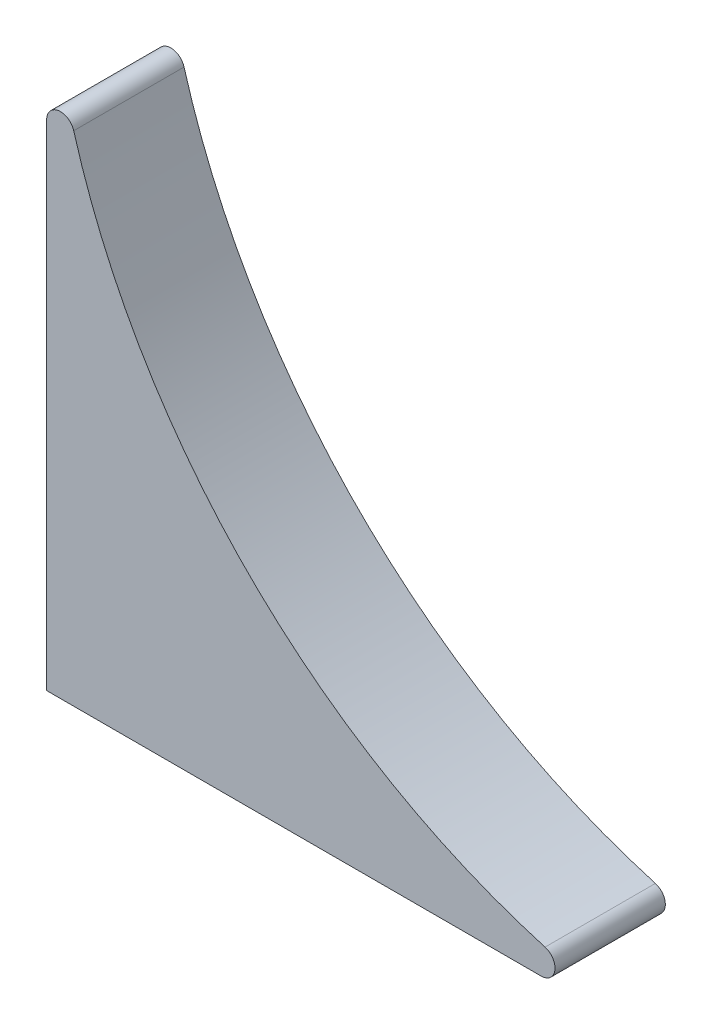
from build123d import *

# Parameters (mm, degrees)
AUFSATZ_LINEAR_AUSTRAGEN1_DEPTH = 4
VERRUNDUNG1_R                   = 0.5


with BuildPart() as part:
    # Skizze1 → Aufsatz-Linear austragen1 (new body)
    with BuildSketch(Plane.XY):
        with BuildLine():
            Line((0, 0), (25, 1.53e-15))
            ThreePointArc((25, 1.53e-15), (7.322330470336308, 7.322330470336315), (0, 25))
            Line((0, 25), (0, 0))
        make_face()
    extrude(amount=AUFSATZ_LINEAR_AUSTRAGEN1_DEPTH)

    # Verrundung1
    verrundung1_edges = [part.edges().sort_by_distance(p)[0] for p in [
        (0, 25, 2),
        (25, -1.01e-15, 2),
    ]]
    fillet(verrundung1_edges, radius=VERRUNDUNG1_R - 0.0001)  # a hair under: the kernel refuses the full size


solid = part.part
